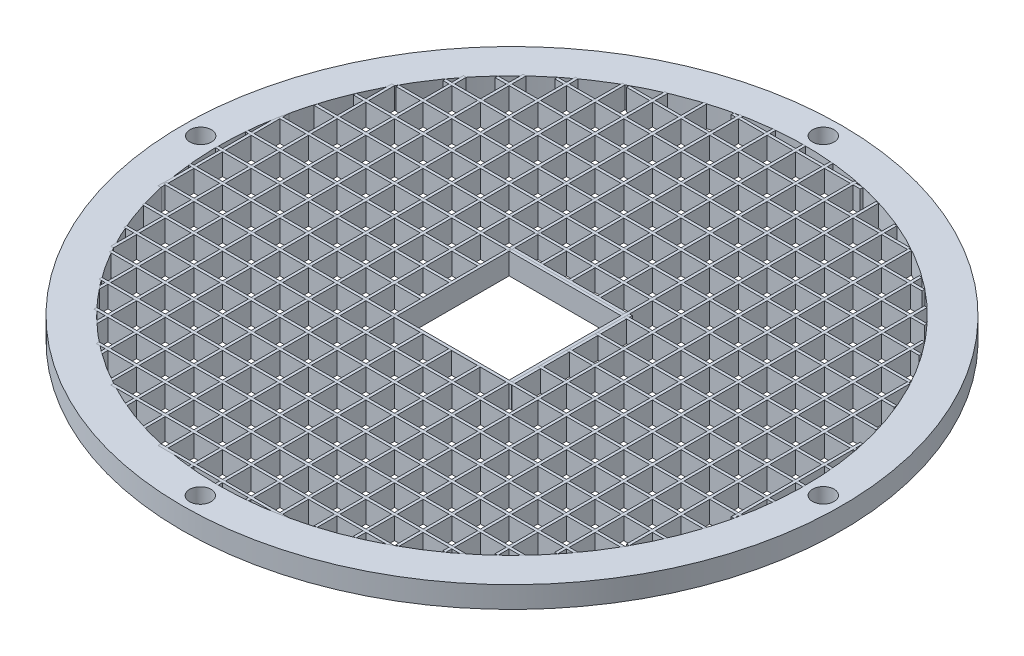
from build123d import *

# Parameters (mm, degrees)
SKETCH2_R              = 46
SKETCH2_R_2            = 41
BOSS_EXTRUDE2_DEPTH    = 3
SKETCH4_W              = 0.4
SKETCH4_H              = 33.006724855
EXTRUDE_THIN5_DEPTH    = 3
SKETCH4_H_2            = 32.811136381
EXTRUDE_THIN5_2_DEPTH  = 3
SKETCH4_H_3            = 80.423877052
EXTRUDE_THIN5_3_DEPTH  = 3
SKETCH4_H_4            = 78.409183136
EXTRUDE_THIN5_4_DEPTH  = 3
SKETCH4_H_5            = 75.498344352
EXTRUDE_THIN5_5_DEPTH  = 3
SKETCH4_H_6            = 71.582120672
EXTRUDE_THIN5_6_DEPTH  = 3
SKETCH4_H_7            = 66.483080554
EXTRUDE_THIN5_7_DEPTH  = 3
SKETCH4_H_8            = 59.899916528
EXTRUDE_THIN5_8_DEPTH  = 3
SKETCH4_H_9            = 51.264022472
EXTRUDE_THIN5_9_DEPTH  = 3
SKETCH4_H_10           = 39.24283374
EXTRUDE_THIN5_10_DEPTH = 3
SKETCH4_H_11           = 18
EXTRUDE_THIN5_11_DEPTH = 3
SKETCH4_W_2            = 33
SKETCH4_H_12           = 0.4
EXTRUDE_THIN5_12_DEPTH = 3
EXTRUDE_THIN5_13_DEPTH = 3
EXTRUDE_THIN5_14_DEPTH = 3
EXTRUDE_THIN5_15_DEPTH = 3
EXTRUDE_THIN5_16_DEPTH = 3
EXTRUDE_THIN5_17_DEPTH = 3
EXTRUDE_THIN5_18_DEPTH = 3
EXTRUDE_THIN5_19_DEPTH = 3
EXTRUDE_THIN5_20_DEPTH = 3
EXTRUDE_THIN5_21_DEPTH = 3
EXTRUDE_THIN5_22_DEPTH = 3
SKETCH4_W_3            = 32.804221652
EXTRUDE_THIN5_23_DEPTH = 3
SKETCH4_W_4            = 80.423877052
EXTRUDE_THIN5_24_DEPTH = 3
SKETCH4_W_5            = 78.409183136
EXTRUDE_THIN5_25_DEPTH = 3
SKETCH4_W_6            = 75.498344352
EXTRUDE_THIN5_26_DEPTH = 3
SKETCH4_W_7            = 71.582120672
EXTRUDE_THIN5_27_DEPTH = 3
SKETCH4_W_8            = 66.483080554
EXTRUDE_THIN5_28_DEPTH = 3
SKETCH4_W_9            = 59.899916528
EXTRUDE_THIN5_29_DEPTH = 3
SKETCH4_W_10           = 51.264022472
EXTRUDE_THIN5_30_DEPTH = 3
SKETCH4_W_11           = 39.24283374
EXTRUDE_THIN5_31_DEPTH = 3
SKETCH4_W_12           = 18
EXTRUDE_THIN5_32_DEPTH = 3
EXTRUDE_THIN5_33_DEPTH = 3
EXTRUDE_THIN5_34_DEPTH = 3
EXTRUDE_THIN5_35_DEPTH = 3
EXTRUDE_THIN5_36_DEPTH = 3
EXTRUDE_THIN5_37_DEPTH = 3
EXTRUDE_THIN5_38_DEPTH = 3
EXTRUDE_THIN5_39_DEPTH = 3
EXTRUDE_THIN5_40_DEPTH = 3
EXTRUDE_THIN5_41_DEPTH = 3
EXTRUDE_THIN5_42_DEPTH = 3
SKETCH4_W_13           = 16.8
SKETCH4_H_13           = 16.830486373
SKETCH4_W_14           = 16
SKETCH4_H_14           = 16.030486373
EXTRUDE_THIN5_43_DEPTH = 3
SKETCH4_H_15           = 32.767200298
EXTRUDE_THIN5_44_DEPTH = 3
EXTRUDE_THIN5_45_DEPTH = 3
SKETCH4_H_16           = 32.962788772
EXTRUDE_THIN5_46_DEPTH = 3
EXTRUDE_THIN5_47_DEPTH = 3
EXTRUDE_THIN5_48_DEPTH = 3
EXTRUDE_THIN5_49_DEPTH = 3
SKETCH5_R              = 1.5
CUT_EXTRUDE1_DEPTH     = 3
SKETCH7_R              = 1.5
CUT_EXTRUDE3_DEPTH     = 66.122960621


with BuildPart() as part:
    # Sketch2 → Boss-Extrude2 (new body)
    with BuildSketch(Plane(origin=(0, 0, 0), x_dir=(1, 0, 0), z_dir=(0, 1, 0))):
        Circle(SKETCH2_R)
        Circle(SKETCH2_R_2, mode=Mode.SUBTRACT)
    extrude(amount=BOSS_EXTRUDE2_DEPTH)

    # Sketch5 → Cut-Extrude1 (cut)
    with BuildSketch(Plane.XZ):
        with Locations((0, -43.452428413)):
            Circle(SKETCH5_R)
        with Locations((-43.452428413, 0)):
            Circle(SKETCH5_R)
        with Locations((43.452428413, 0)):
            Circle(SKETCH5_R)
    extrude(amount=-CUT_EXTRUDE1_DEPTH, mode=Mode.SUBTRACT)

    # Sketch7 → Cut-Extrude3 (cut, through all)
    with BuildSketch(Plane(origin=(0, 3, 0), x_dir=(1, 0, 0), z_dir=(0, 1, 0))):
        with Locations((0, -43.5)):
            Circle(SKETCH7_R)
    extrude(amount=-CUT_EXTRUDE3_DEPTH, mode=Mode.SUBTRACT)


with BuildPart() as body_2:
    # Sketch4 → Extrude-Thin5 (new body)
    with BuildSketch(Plane(origin=(0, 3, 0), x_dir=(1, 0, 0), z_dir=(0, 1, 0))):
        with Locations((-0.2, 24.496637572)):
            Rectangle(SKETCH4_W, SKETCH4_H)
    extrude(amount=-EXTRUDE_THIN5_DEPTH)


with BuildPart() as body_3:
    # Sketch4 → Extrude-Thin5 2 (new body)
    with BuildSketch(Plane(origin=(0, 3, 0), x_dir=(1, 0, 0), z_dir=(0, 1, 0))):
        with Locations((3.8, 24.398843336)):
            Rectangle(SKETCH4_W, SKETCH4_H_2)
    extrude(amount=-EXTRUDE_THIN5_2_DEPTH)


with BuildPart() as body_4:
    # Sketch4 → Extrude-Thin5 3 (new body)
    with BuildSketch(Plane(origin=(0, 3, 0), x_dir=(1, 0, 0), z_dir=(0, 1, 0))):
        with Locations((7.8, 0)):
            Rectangle(SKETCH4_W, SKETCH4_H_3)
    extrude(amount=-EXTRUDE_THIN5_3_DEPTH)


with BuildPart() as body_5:
    # Sketch4 → Extrude-Thin5 4 (new body)
    with BuildSketch(Plane(origin=(0, 3, 0), x_dir=(1, 0, 0), z_dir=(0, 1, 0))):
        with Locations((11.8, 0)):
            Rectangle(SKETCH4_W, SKETCH4_H_4)
    extrude(amount=-EXTRUDE_THIN5_4_DEPTH)


with BuildPart() as body_6:
    # Sketch4 → Extrude-Thin5 5 (new body)
    with BuildSketch(Plane(origin=(0, 3, 0), x_dir=(1, 0, 0), z_dir=(0, 1, 0))):
        with Locations((15.8, 0)):
            Rectangle(SKETCH4_W, SKETCH4_H_5)
    extrude(amount=-EXTRUDE_THIN5_5_DEPTH)


with BuildPart() as body_7:
    # Sketch4 → Extrude-Thin5 6 (new body)
    with BuildSketch(Plane(origin=(0, 3, 0), x_dir=(1, 0, 0), z_dir=(0, 1, 0))):
        with Locations((19.8, 0)):
            Rectangle(SKETCH4_W, SKETCH4_H_6)
    extrude(amount=-EXTRUDE_THIN5_6_DEPTH)


with BuildPart() as body_8:
    # Sketch4 → Extrude-Thin5 7 (new body)
    with BuildSketch(Plane(origin=(0, 3, 0), x_dir=(1, 0, 0), z_dir=(0, 1, 0))):
        with Locations((23.8, 0)):
            Rectangle(SKETCH4_W, SKETCH4_H_7)
    extrude(amount=-EXTRUDE_THIN5_7_DEPTH)


with BuildPart() as body_9:
    # Sketch4 → Extrude-Thin5 8 (new body)
    with BuildSketch(Plane(origin=(0, 3, 0), x_dir=(1, 0, 0), z_dir=(0, 1, 0))):
        with Locations((27.8, 0)):
            Rectangle(SKETCH4_W, SKETCH4_H_8)
    extrude(amount=-EXTRUDE_THIN5_8_DEPTH)


with BuildPart() as body_10:
    # Sketch4 → Extrude-Thin5 9 (new body)
    with BuildSketch(Plane(origin=(0, 3, 0), x_dir=(1, 0, 0), z_dir=(0, 1, 0))):
        with Locations((31.8, 0)):
            Rectangle(SKETCH4_W, SKETCH4_H_9)
    extrude(amount=-EXTRUDE_THIN5_9_DEPTH)


with BuildPart() as body_11:
    # Sketch4 → Extrude-Thin5 10 (new body)
    with BuildSketch(Plane(origin=(0, 3, 0), x_dir=(1, 0, 0), z_dir=(0, 1, 0))):
        with Locations((35.8, 0)):
            Rectangle(SKETCH4_W, SKETCH4_H_10)
    extrude(amount=-EXTRUDE_THIN5_10_DEPTH)


with BuildPart() as body_12:
    # Sketch4 → Extrude-Thin5 11 (new body)
    with BuildSketch(Plane(origin=(0, 3, 0), x_dir=(1, 0, 0), z_dir=(0, 1, 0))):
        with Locations((39.8, 0)):
            Rectangle(SKETCH4_W, SKETCH4_H_11)
    extrude(amount=-EXTRUDE_THIN5_11_DEPTH)


with BuildPart() as body_13:
    # Sketch4 → Extrude-Thin5 12 (new body)
    with BuildSketch(Plane(origin=(0, 3, 0), x_dir=(1, 0, 0), z_dir=(0, 1, 0))):
        with Locations((-24.5, -0.2)):
            Rectangle(SKETCH4_W_2, SKETCH4_H_12)
    extrude(amount=-EXTRUDE_THIN5_12_DEPTH)


with BuildPart() as body_14:
    # Sketch4 → Extrude-Thin5 13 (new body)
    with BuildSketch(Plane(origin=(0, 3, 0), x_dir=(1, 0, 0), z_dir=(0, 1, 0))):
        with Locations((-4.2, 24.398843336)):
            Rectangle(SKETCH4_W, SKETCH4_H_2)
    extrude(amount=-EXTRUDE_THIN5_13_DEPTH)


with BuildPart() as body_15:
    # Sketch4 → Extrude-Thin5 14 (new body)
    with BuildSketch(Plane(origin=(0, 3, 0), x_dir=(1, 0, 0), z_dir=(0, 1, 0))):
        with Locations((-8.2, 0)):
            Rectangle(SKETCH4_W, SKETCH4_H_3)
    extrude(amount=-EXTRUDE_THIN5_14_DEPTH)


with BuildPart() as body_16:
    # Sketch4 → Extrude-Thin5 15 (new body)
    with BuildSketch(Plane(origin=(0, 3, 0), x_dir=(1, 0, 0), z_dir=(0, 1, 0))):
        with Locations((-12.2, 0)):
            Rectangle(SKETCH4_W, SKETCH4_H_4)
    extrude(amount=-EXTRUDE_THIN5_15_DEPTH)


with BuildPart() as body_17:
    # Sketch4 → Extrude-Thin5 16 (new body)
    with BuildSketch(Plane(origin=(0, 3, 0), x_dir=(1, 0, 0), z_dir=(0, 1, 0))):
        with Locations((-16.2, 0)):
            Rectangle(SKETCH4_W, SKETCH4_H_5)
    extrude(amount=-EXTRUDE_THIN5_16_DEPTH)


with BuildPart() as body_18:
    # Sketch4 → Extrude-Thin5 17 (new body)
    with BuildSketch(Plane(origin=(0, 3, 0), x_dir=(1, 0, 0), z_dir=(0, 1, 0))):
        with Locations((-20.2, 0)):
            Rectangle(SKETCH4_W, SKETCH4_H_6)
    extrude(amount=-EXTRUDE_THIN5_17_DEPTH)


with BuildPart() as body_19:
    # Sketch4 → Extrude-Thin5 18 (new body)
    with BuildSketch(Plane(origin=(0, 3, 0), x_dir=(1, 0, 0), z_dir=(0, 1, 0))):
        with Locations((-24.2, 0)):
            Rectangle(SKETCH4_W, SKETCH4_H_7)
    extrude(amount=-EXTRUDE_THIN5_18_DEPTH)


with BuildPart() as body_20:
    # Sketch4 → Extrude-Thin5 19 (new body)
    with BuildSketch(Plane(origin=(0, 3, 0), x_dir=(1, 0, 0), z_dir=(0, 1, 0))):
        with Locations((-28.2, 0)):
            Rectangle(SKETCH4_W, SKETCH4_H_8)
    extrude(amount=-EXTRUDE_THIN5_19_DEPTH)


with BuildPart() as body_21:
    # Sketch4 → Extrude-Thin5 20 (new body)
    with BuildSketch(Plane(origin=(0, 3, 0), x_dir=(1, 0, 0), z_dir=(0, 1, 0))):
        with Locations((-32.2, 0)):
            Rectangle(SKETCH4_W, SKETCH4_H_9)
    extrude(amount=-EXTRUDE_THIN5_20_DEPTH)


with BuildPart() as body_22:
    # Sketch4 → Extrude-Thin5 21 (new body)
    with BuildSketch(Plane(origin=(0, 3, 0), x_dir=(1, 0, 0), z_dir=(0, 1, 0))):
        with Locations((-36.2, 0)):
            Rectangle(SKETCH4_W, SKETCH4_H_10)
    extrude(amount=-EXTRUDE_THIN5_21_DEPTH)


with BuildPart() as body_23:
    # Sketch4 → Extrude-Thin5 22 (new body)
    with BuildSketch(Plane(origin=(0, 3, 0), x_dir=(1, 0, 0), z_dir=(0, 1, 0))):
        with Locations((-40.2, 0)):
            Rectangle(SKETCH4_W, SKETCH4_H_11)
    extrude(amount=-EXTRUDE_THIN5_22_DEPTH)


with BuildPart() as body_24:
    # Sketch4 → Extrude-Thin5 23 (new body)
    with BuildSketch(Plane(origin=(0, 3, 0), x_dir=(1, 0, 0), z_dir=(0, 1, 0))):
        with Locations((-24.402110826, -4.2)):
            Rectangle(SKETCH4_W_3, SKETCH4_H_12)
    extrude(amount=-EXTRUDE_THIN5_23_DEPTH)


with BuildPart() as body_25:
    # Sketch4 → Extrude-Thin5 24 (new body)
    with BuildSketch(Plane(origin=(0, 3, 0), x_dir=(1, 0, 0), z_dir=(0, 1, 0))):
        with Locations((0, -8.2)):
            Rectangle(SKETCH4_W_4, SKETCH4_H_12)
    extrude(amount=-EXTRUDE_THIN5_24_DEPTH)


with BuildPart() as body_26:
    # Sketch4 → Extrude-Thin5 25 (new body)
    with BuildSketch(Plane(origin=(0, 3, 0), x_dir=(1, 0, 0), z_dir=(0, 1, 0))):
        with Locations((0, -12.2)):
            Rectangle(SKETCH4_W_5, SKETCH4_H_12)
    extrude(amount=-EXTRUDE_THIN5_25_DEPTH)


with BuildPart() as body_27:
    # Sketch4 → Extrude-Thin5 26 (new body)
    with BuildSketch(Plane(origin=(0, 3, 0), x_dir=(1, 0, 0), z_dir=(0, 1, 0))):
        with Locations((0, -16.2)):
            Rectangle(SKETCH4_W_6, SKETCH4_H_12)
    extrude(amount=-EXTRUDE_THIN5_26_DEPTH)


with BuildPart() as body_28:
    # Sketch4 → Extrude-Thin5 27 (new body)
    with BuildSketch(Plane(origin=(0, 3, 0), x_dir=(1, 0, 0), z_dir=(0, 1, 0))):
        with Locations((0, -20.2)):
            Rectangle(SKETCH4_W_7, SKETCH4_H_12)
    extrude(amount=-EXTRUDE_THIN5_27_DEPTH)


with BuildPart() as body_29:
    # Sketch4 → Extrude-Thin5 28 (new body)
    with BuildSketch(Plane(origin=(0, 3, 0), x_dir=(1, 0, 0), z_dir=(0, 1, 0))):
        with Locations((0, -24.2)):
            Rectangle(SKETCH4_W_8, SKETCH4_H_12)
    extrude(amount=-EXTRUDE_THIN5_28_DEPTH)


with BuildPart() as body_30:
    # Sketch4 → Extrude-Thin5 29 (new body)
    with BuildSketch(Plane(origin=(0, 3, 0), x_dir=(1, 0, 0), z_dir=(0, 1, 0))):
        with Locations((0, -28.2)):
            Rectangle(SKETCH4_W_9, SKETCH4_H_12)
    extrude(amount=-EXTRUDE_THIN5_29_DEPTH)


with BuildPart() as body_31:
    # Sketch4 → Extrude-Thin5 30 (new body)
    with BuildSketch(Plane(origin=(0, 3, 0), x_dir=(1, 0, 0), z_dir=(0, 1, 0))):
        with Locations((0, -32.2)):
            Rectangle(SKETCH4_W_10, SKETCH4_H_12)
    extrude(amount=-EXTRUDE_THIN5_30_DEPTH)


with BuildPart() as body_32:
    # Sketch4 → Extrude-Thin5 31 (new body)
    with BuildSketch(Plane(origin=(0, 3, 0), x_dir=(1, 0, 0), z_dir=(0, 1, 0))):
        with Locations((0, -36.2)):
            Rectangle(SKETCH4_W_11, SKETCH4_H_12)
    extrude(amount=-EXTRUDE_THIN5_31_DEPTH)


with BuildPart() as body_33:
    # Sketch4 → Extrude-Thin5 32 (new body)
    with BuildSketch(Plane(origin=(0, 3, 0), x_dir=(1, 0, 0), z_dir=(0, 1, 0))):
        with Locations((0, -40.2)):
            Rectangle(SKETCH4_W_12, SKETCH4_H_12)
    extrude(amount=-EXTRUDE_THIN5_32_DEPTH)


with BuildPart() as body_34:
    # Sketch4 → Extrude-Thin5 33 (new body)
    with BuildSketch(Plane(origin=(0, 3, 0), x_dir=(1, 0, 0), z_dir=(0, 1, 0))):
        with Locations((0, 39.8)):
            Rectangle(SKETCH4_W_12, SKETCH4_H_12)
    extrude(amount=-EXTRUDE_THIN5_33_DEPTH)


with BuildPart() as body_35:
    # Sketch4 → Extrude-Thin5 34 (new body)
    with BuildSketch(Plane(origin=(0, 3, 0), x_dir=(1, 0, 0), z_dir=(0, 1, 0))):
        with Locations((0, 35.8)):
            Rectangle(SKETCH4_W_11, SKETCH4_H_12)
    extrude(amount=-EXTRUDE_THIN5_34_DEPTH)


with BuildPart() as body_36:
    # Sketch4 → Extrude-Thin5 35 (new body)
    with BuildSketch(Plane(origin=(0, 3, 0), x_dir=(1, 0, 0), z_dir=(0, 1, 0))):
        with Locations((0, 31.8)):
            Rectangle(SKETCH4_W_10, SKETCH4_H_12)
    extrude(amount=-EXTRUDE_THIN5_35_DEPTH)


with BuildPart() as body_37:
    # Sketch4 → Extrude-Thin5 36 (new body)
    with BuildSketch(Plane(origin=(0, 3, 0), x_dir=(1, 0, 0), z_dir=(0, 1, 0))):
        with Locations((0, 27.8)):
            Rectangle(SKETCH4_W_9, SKETCH4_H_12)
    extrude(amount=-EXTRUDE_THIN5_36_DEPTH)


with BuildPart() as body_38:
    # Sketch4 → Extrude-Thin5 37 (new body)
    with BuildSketch(Plane(origin=(0, 3, 0), x_dir=(1, 0, 0), z_dir=(0, 1, 0))):
        with Locations((0, 23.8)):
            Rectangle(SKETCH4_W_8, SKETCH4_H_12)
    extrude(amount=-EXTRUDE_THIN5_37_DEPTH)


with BuildPart() as body_39:
    # Sketch4 → Extrude-Thin5 38 (new body)
    with BuildSketch(Plane(origin=(0, 3, 0), x_dir=(1, 0, 0), z_dir=(0, 1, 0))):
        with Locations((0, 19.8)):
            Rectangle(SKETCH4_W_7, SKETCH4_H_12)
    extrude(amount=-EXTRUDE_THIN5_38_DEPTH)


with BuildPart() as body_40:
    # Sketch4 → Extrude-Thin5 39 (new body)
    with BuildSketch(Plane(origin=(0, 3, 0), x_dir=(1, 0, 0), z_dir=(0, 1, 0))):
        with Locations((0, 15.8)):
            Rectangle(SKETCH4_W_6, SKETCH4_H_12)
    extrude(amount=-EXTRUDE_THIN5_39_DEPTH)


with BuildPart() as body_41:
    # Sketch4 → Extrude-Thin5 40 (new body)
    with BuildSketch(Plane(origin=(0, 3, 0), x_dir=(1, 0, 0), z_dir=(0, 1, 0))):
        with Locations((0, 11.8)):
            Rectangle(SKETCH4_W_5, SKETCH4_H_12)
    extrude(amount=-EXTRUDE_THIN5_40_DEPTH)


with BuildPart() as body_42:
    # Sketch4 → Extrude-Thin5 41 (new body)
    with BuildSketch(Plane(origin=(0, 3, 0), x_dir=(1, 0, 0), z_dir=(0, 1, 0))):
        with Locations((0, 7.8)):
            Rectangle(SKETCH4_W_4, SKETCH4_H_12)
    extrude(amount=-EXTRUDE_THIN5_41_DEPTH)


with BuildPart() as body_43:
    # Sketch4 → Extrude-Thin5 42 (new body)
    with BuildSketch(Plane(origin=(0, 3, 0), x_dir=(1, 0, 0), z_dir=(0, 1, 0))):
        with Locations((-24.402110826, 3.8)):
            Rectangle(SKETCH4_W_3, SKETCH4_H_12)
    extrude(amount=-EXTRUDE_THIN5_42_DEPTH)


with BuildPart() as body_44:
    # Sketch4 → Extrude-Thin5 43 (new body)
    with BuildSketch(Plane(origin=(0, 3, 0), x_dir=(1, 0, 0), z_dir=(0, 1, 0))):
        with Locations((0, -0.021968042)):
            Rectangle(SKETCH4_W_13, SKETCH4_H_13)
        with Locations((0, -0.021968042)):
            Rectangle(SKETCH4_W_14, SKETCH4_H_14, mode=Mode.SUBTRACT)
    extrude(amount=-EXTRUDE_THIN5_43_DEPTH)


with BuildPart() as body_45:
    # Sketch4 → Extrude-Thin5 44 (new body)
    with BuildSketch(Plane(origin=(0, 3, 0), x_dir=(1, 0, 0), z_dir=(0, 1, 0))):
        with Locations((-4.2, -24.420811377)):
            Rectangle(SKETCH4_W, SKETCH4_H_15)
    extrude(amount=-EXTRUDE_THIN5_44_DEPTH)


with BuildPart() as body_46:
    # Sketch4 → Extrude-Thin5 45 (new body)
    with BuildSketch(Plane(origin=(0, 3, 0), x_dir=(1, 0, 0), z_dir=(0, 1, 0))):
        with Locations((24.402110826, 3.8)):
            Rectangle(SKETCH4_W_3, SKETCH4_H_12)
    extrude(amount=-EXTRUDE_THIN5_45_DEPTH)


with BuildPart() as body_47:
    # Sketch4 → Extrude-Thin5 46 (new body)
    with BuildSketch(Plane(origin=(0, 3, 0), x_dir=(1, 0, 0), z_dir=(0, 1, 0))):
        with Locations((-0.2, -24.518605614)):
            Rectangle(SKETCH4_W, SKETCH4_H_16)
    extrude(amount=-EXTRUDE_THIN5_46_DEPTH)


with BuildPart() as body_48:
    # Sketch4 → Extrude-Thin5 47 (new body)
    with BuildSketch(Plane(origin=(0, 3, 0), x_dir=(1, 0, 0), z_dir=(0, 1, 0))):
        with Locations((3.8, -24.420811377)):
            Rectangle(SKETCH4_W, SKETCH4_H_15)
    extrude(amount=-EXTRUDE_THIN5_47_DEPTH)


with BuildPart() as body_49:
    # Sketch4 → Extrude-Thin5 48 (new body)
    with BuildSketch(Plane(origin=(0, 3, 0), x_dir=(1, 0, 0), z_dir=(0, 1, 0))):
        with Locations((24.5, -0.2)):
            Rectangle(SKETCH4_W_2, SKETCH4_H_12)
    extrude(amount=-EXTRUDE_THIN5_48_DEPTH)


with BuildPart() as body_50:
    # Sketch4 → Extrude-Thin5 49 (new body)
    with BuildSketch(Plane(origin=(0, 3, 0), x_dir=(1, 0, 0), z_dir=(0, 1, 0))):
        with Locations((24.402110826, -4.2)):
            Rectangle(SKETCH4_W_3, SKETCH4_H_12)
    extrude(amount=-EXTRUDE_THIN5_49_DEPTH)


solid = Compound([part.part, body_2.part, body_3.part, body_4.part, body_5.part, body_6.part, body_7.part, body_8.part, body_9.part, body_10.part, body_11.part, body_12.part, body_13.part, body_14.part, body_15.part, body_16.part, body_17.part, body_18.part, body_19.part, body_20.part, body_21.part, body_22.part, body_23.part, body_24.part, body_25.part, body_26.part, body_27.part, body_28.part, body_29.part, body_30.part, body_31.part, body_32.part, body_33.part, body_34.part, body_35.part, body_36.part, body_37.part, body_38.part, body_39.part, body_40.part, body_41.part, body_42.part, body_43.part, body_44.part, body_45.part, body_46.part, body_47.part, body_48.part, body_49.part, body_50.part])
